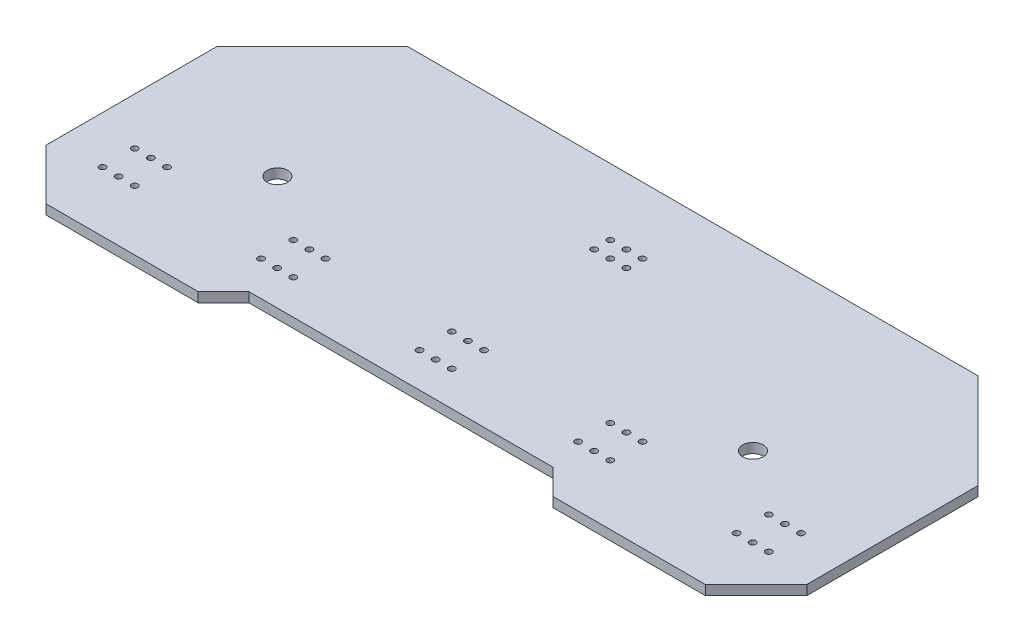
from build123d import *

# Parameters (mm, degrees)
SKETCH1_W             = 120
SKETCH1_H             = 50
BOSS_EXTRUDE1_DEPTH   = 1.53
SKETCH2_R             = 0.5
PUSHBUTTONHOLES_DEPTH = 67.229456437
SKETCH7_R             = 1.625
MOUNT_HOLES_DEPTH     = 67.229456437
SKETCH5_R             = 0.5
RJ12HOLES_DEPTH       = 67.229456437
SKETCH6_W             = 141.050966046
SKETCH6_H             = 69.53153639
CUT_EXTRUDE4_DEPTH    = 67.229456437
LPATTERN1_COUNT       = 3
LPATTERN1_PITCH       = 25
LPATTERN1_COL_COUNT   = 3
LPATTERN1_COL_PITCH   = 25


with BuildPart() as part:
    # Sketch1 → Boss-Extrude1 (new body)
    with BuildSketch(Plane(origin=(0, 0, 0), x_dir=(1, 0, 0), z_dir=(0, 1, 0))):
        with Locations((0, 3)):
            Rectangle(SKETCH1_W, SKETCH1_H)
    extrude(amount=BOSS_EXTRUDE1_DEPTH)

    # Sketch2 → PushButtonHoles (cut, through all)
    with BuildSketch(Plane(origin=(0, 1.53, 0), x_dir=(1, 0, 0), z_dir=(0, 1, 0))):
        with Locations((-2.54, -7.46)):
            Circle(SKETCH2_R)
        with Locations((0, -7.46)):
            Circle(SKETCH2_R)
        with Locations((2.54, -7.46)):
            Circle(SKETCH2_R)
        with Locations((-2.54, -12.54)):
            Circle(SKETCH2_R)
        with Locations((0, -12.54)):
            Circle(SKETCH2_R)
        with Locations((2.54, -12.54)):
            Circle(SKETCH2_R)
    pushbuttonholes = extrude(amount=-PUSHBUTTONHOLES_DEPTH, mode=Mode.SUBTRACT)

    # Sketch7 → Mount Holes (cut, through all)
    with BuildSketch(Plane(origin=(0, 1.53, 0), x_dir=(1, 0, 0), z_dir=(0, 1, 0))):
        with Locations((-37.5, 0)):
            Circle(SKETCH7_R)
        with Locations((37.5, 0)):
            Circle(SKETCH7_R)
    extrude(amount=-MOUNT_HOLES_DEPTH, mode=Mode.SUBTRACT)

    # Sketch5 → RJ12Holes (cut, through all)
    with BuildSketch(Plane(origin=(0, 1.53, 0), x_dir=(1, 0, 0), z_dir=(0, 1, 0))):
        with Locations((-2.54, 17.54)):
            Circle(SKETCH5_R)
        with Locations((0, 17.54)):
            Circle(SKETCH5_R)
        with Locations((2.54, 17.54)):
            Circle(SKETCH5_R)
        with Locations((-2.54, 15)):
            Circle(SKETCH5_R)
        with Locations((0, 15)):
            Circle(SKETCH5_R)
        with Locations((2.54, 15)):
            Circle(SKETCH5_R)
    extrude(amount=-RJ12HOLES_DEPTH, mode=Mode.SUBTRACT)

    # Sketch6 → Cut-Extrude4 (cut, through all)
    with BuildSketch(Plane(origin=(0, 1.53, 0), x_dir=(1, 0, 0), z_dir=(0, 1, 0))):
        Rectangle(SKETCH6_W, SKETCH6_H)
        Polygon((-45, 28), (-60, 13), (-60, -14), (-52, -22), (-28, -22), (-24, -18), (24, -18), (28, -22), (52, -22), (60, -14), (60, 13), (45, 28), align=None, mode=Mode.SUBTRACT)
    extrude(amount=-CUT_EXTRUDE4_DEPTH, mode=Mode.SUBTRACT)

    # LPattern1: PushButtonHoles ×3
    with Locations(*[(i * LPATTERN1_PITCH, 0, 0) for i in range(1, LPATTERN1_COUNT)]):
        add(pushbuttonholes, mode=Mode.SUBTRACT)

    # LPattern1 col: PushButtonHoles ×3
    with Locations(*[(-i * LPATTERN1_COL_PITCH, 0, 0) for i in range(1, LPATTERN1_COL_COUNT)]):
        add(pushbuttonholes, mode=Mode.SUBTRACT)


solid = part.part
